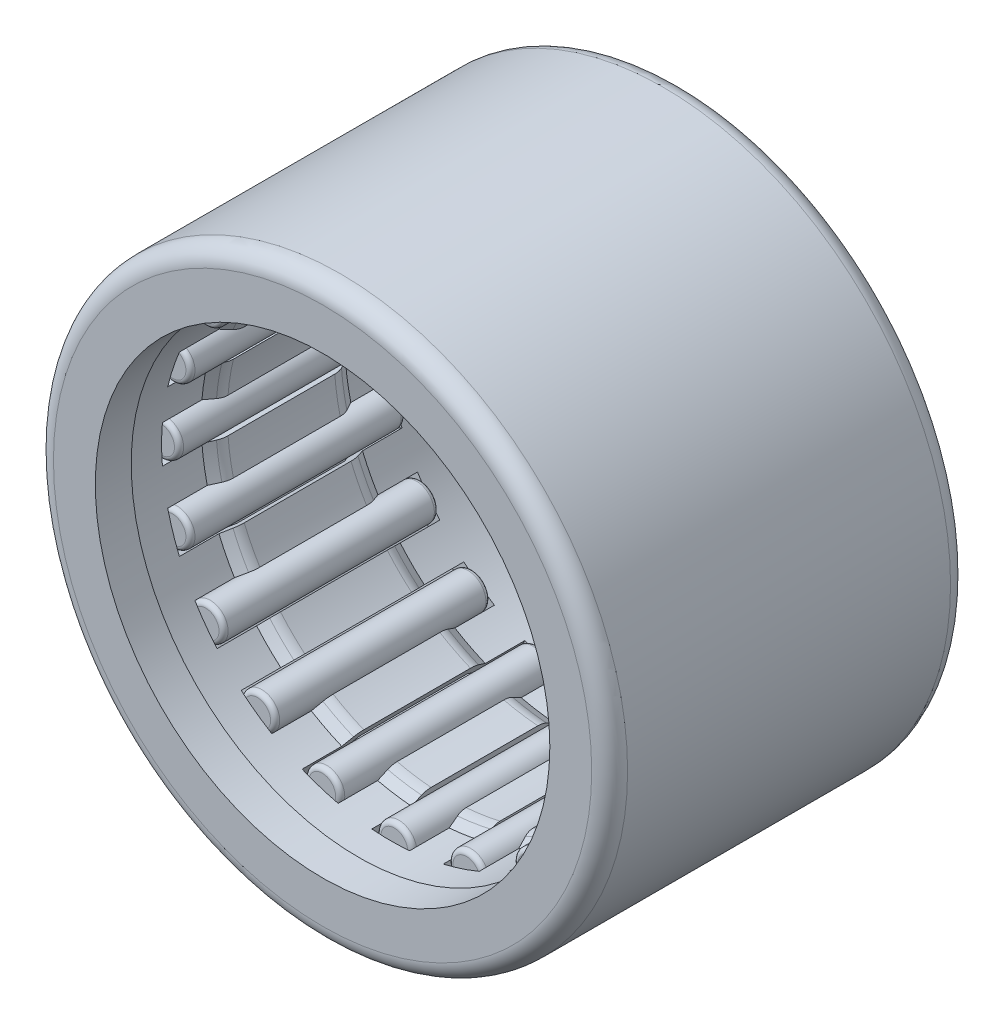
from build123d import *

# Parameters (mm, degrees)
FILLET1_R          = 0.5
SKETCH4_W          = 6
SKETCH4_H          = 0.5
FILLET2_R          = 0.127
CIRPATTERN1_COUNT  = 20
FILLET3_R          = 0.508
CUT_EXTRUDE1_DEPTH = 3.1016
CIRPATTERN2_COUNT  = 20


with BuildPart() as part:
    # Sketch3 → Revolve1 (revolve)
    with BuildSketch(Plane(origin=(0, 0, 0), x_dir=(0, 0, -1), z_dir=(1, 0, 0)), mode=Mode.PRIVATE) as revolve1_sk:
        Polygon((4, 7.333333333), (4, 6.333333333), (5, 6.333333333), (5, 8), (-5, 8), (-5, 6.333333333), (-4, 6.333333333), (-4, 7.333333333), align=None)
    revolve(revolve1_sk.sketch.rotate(Axis((0, 0, 5), (0, 0, -1)), 90), axis=Axis((0, 0, 5), (0, 0, -1)))

    # Fillet1
    fillet1_edges = [part.edges().sort_by_distance(p)[0] for p in [
        (-8, 0, -5),
        (-8, 0, 5),
    ]]
    fillet(fillet1_edges, radius=FILLET1_R)


with BuildPart() as body_2:
    # Sketch4 → Revolve2 (revolve)
    with BuildSketch(Plane(origin=(0, 0, 0), x_dir=(0, 0, -1), z_dir=(1, 0, 0)), mode=Mode.PRIVATE) as revolve2_sk:
        with Locations((0, 6.25)):
            Rectangle(SKETCH4_W, SKETCH4_H)
    revolve(revolve2_sk.sketch.rotate(Axis((0, 6.5, 3), (0, 0, -1)), 270), axis=Axis((0, 6.5, 3), (0, 0, -1)))

    # Fillet2
    fillet2_edges = [body_2.edges().sort_by_distance(p)[0] for p in [
        (-0.5, 6.5, 3),
        (-0.5, 6.5, -3),
    ]]
    fillet(fillet2_edges, radius=FILLET2_R)


with BuildPart() as cirpattern1_1:
    # CirPattern1: pattern copy
    add(body_2.part.rotate(Axis((0, 0, 0), (0, 0, 1)), 1 * 360 / CIRPATTERN1_COUNT))


with BuildPart() as cirpattern1_2:
    # CirPattern1: pattern copy
    add(body_2.part.rotate(Axis((0, 0, 0), (0, 0, 1)), 2 * 360 / CIRPATTERN1_COUNT))


with BuildPart() as cirpattern1_3:
    # CirPattern1: pattern copy
    add(body_2.part.rotate(Axis((0, 0, 0), (0, 0, 1)), 3 * 360 / CIRPATTERN1_COUNT))


with BuildPart() as cirpattern1_4:
    # CirPattern1: pattern copy
    add(body_2.part.rotate(Axis((0, 0, 0), (0, 0, 1)), 4 * 360 / CIRPATTERN1_COUNT))


with BuildPart() as cirpattern1_5:
    # CirPattern1: pattern copy
    add(body_2.part.rotate(Axis((0, 0, 0), (0, 0, 1)), 5 * 360 / CIRPATTERN1_COUNT))


with BuildPart() as cirpattern1_6:
    # CirPattern1: pattern copy
    add(body_2.part.rotate(Axis((0, 0, 0), (0, 0, 1)), 6 * 360 / CIRPATTERN1_COUNT))


with BuildPart() as cirpattern1_7:
    # CirPattern1: pattern copy
    add(body_2.part.rotate(Axis((0, 0, 0), (0, 0, 1)), 7 * 360 / CIRPATTERN1_COUNT))


with BuildPart() as cirpattern1_8:
    # CirPattern1: pattern copy
    add(body_2.part.rotate(Axis((0, 0, 0), (0, 0, 1)), 8 * 360 / CIRPATTERN1_COUNT))


with BuildPart() as cirpattern1_9:
    # CirPattern1: pattern copy
    add(body_2.part.rotate(Axis((0, 0, 0), (0, 0, 1)), 9 * 360 / CIRPATTERN1_COUNT))


with BuildPart() as cirpattern1_10:
    # CirPattern1: pattern copy
    add(body_2.part.rotate(Axis((0, 0, 0), (0, 0, 1)), 10 * 360 / CIRPATTERN1_COUNT))


with BuildPart() as cirpattern1_11:
    # CirPattern1: pattern copy
    add(body_2.part.rotate(Axis((0, 0, 0), (0, 0, 1)), 11 * 360 / CIRPATTERN1_COUNT))


with BuildPart() as cirpattern1_12:
    # CirPattern1: pattern copy
    add(body_2.part.rotate(Axis((0, 0, 0), (0, 0, 1)), 12 * 360 / CIRPATTERN1_COUNT))


with BuildPart() as cirpattern1_13:
    # CirPattern1: pattern copy
    add(body_2.part.rotate(Axis((0, 0, 0), (0, 0, 1)), 13 * 360 / CIRPATTERN1_COUNT))


with BuildPart() as cirpattern1_14:
    # CirPattern1: pattern copy
    add(body_2.part.rotate(Axis((0, 0, 0), (0, 0, 1)), 14 * 360 / CIRPATTERN1_COUNT))


with BuildPart() as cirpattern1_15:
    # CirPattern1: pattern copy
    add(body_2.part.rotate(Axis((0, 0, 0), (0, 0, 1)), 15 * 360 / CIRPATTERN1_COUNT))


with BuildPart() as cirpattern1_16:
    # CirPattern1: pattern copy
    add(body_2.part.rotate(Axis((0, 0, 0), (0, 0, 1)), 16 * 360 / CIRPATTERN1_COUNT))


with BuildPart() as cirpattern1_17:
    # CirPattern1: pattern copy
    add(body_2.part.rotate(Axis((0, 0, 0), (0, 0, 1)), 17 * 360 / CIRPATTERN1_COUNT))


with BuildPart() as cirpattern1_18:
    # CirPattern1: pattern copy
    add(body_2.part.rotate(Axis((0, 0, 0), (0, 0, 1)), 18 * 360 / CIRPATTERN1_COUNT))


with BuildPart() as cirpattern1_19:
    # CirPattern1: pattern copy
    add(body_2.part.rotate(Axis((0, 0, 0), (0, 0, 1)), 19 * 360 / CIRPATTERN1_COUNT))


with BuildPart() as body_22:
    # Sketch6 → Revolve3 (revolve)
    with BuildSketch(Plane(origin=(0, 0, 0), x_dir=(0, 0, -1), z_dir=(1, 0, 0)), mode=Mode.PRIVATE) as revolve3_sk:
        Polygon((-4, 6.384133333), (-4, 6.833333333), (-2.275819469, 6.833333333), (-1.497782246, 6.384133333), (1.497782246, 6.384133333), (2.275819469, 6.833333333), (4, 6.833333333), (4, 6.384133333), (2, 6.384133333), (1.623336684, 6.166666667), (-1.623336684, 6.166666667), (-2, 6.384133333), align=None)
    revolve(revolve3_sk.sketch.rotate(Axis((0, 0, 5), (0, 0, -1)), 90), axis=Axis((0, 0, 5), (0, 0, -1)))

    # Fillet3
    fillet3_edges = [body_22.edges().sort_by_distance(p)[0] for p in [
        (-6.166666667, 0, -1.623336684),
        (-6.166666667, 0, 1.623336684),
    ]]
    fillet(fillet3_edges, radius=FILLET3_R)

    # Sketch7 → Cut-Extrude1 (cut, symmetric)
    with BuildSketch(Plane.XY):
        Polygon((-0.453679099, 5.9492), (0.453679099, 5.9492), (0.647920901, 7.0508), (-0.647920901, 7.0508), align=None)
    cut_extrude1 = extrude(amount=CUT_EXTRUDE1_DEPTH, both=True, mode=Mode.SUBTRACT)

    # CirPattern2: Cut-Extrude1 ×20 about axis
    cirpattern2_axis = Axis((0, 0, 0), (0, 0, 1))
    for i in range(1, CIRPATTERN2_COUNT):
        add(cut_extrude1.rotate(cirpattern2_axis, i * 360 / CIRPATTERN2_COUNT), mode=Mode.SUBTRACT)


solid = Compound([part.part, body_2.part, cirpattern1_1.part, cirpattern1_2.part, cirpattern1_3.part, cirpattern1_4.part, cirpattern1_5.part, cirpattern1_6.part, cirpattern1_7.part, cirpattern1_8.part, cirpattern1_9.part, cirpattern1_10.part, cirpattern1_11.part, cirpattern1_12.part, cirpattern1_13.part, cirpattern1_14.part, cirpattern1_15.part, cirpattern1_16.part, cirpattern1_17.part, cirpattern1_18.part, cirpattern1_19.part, body_22.part])
